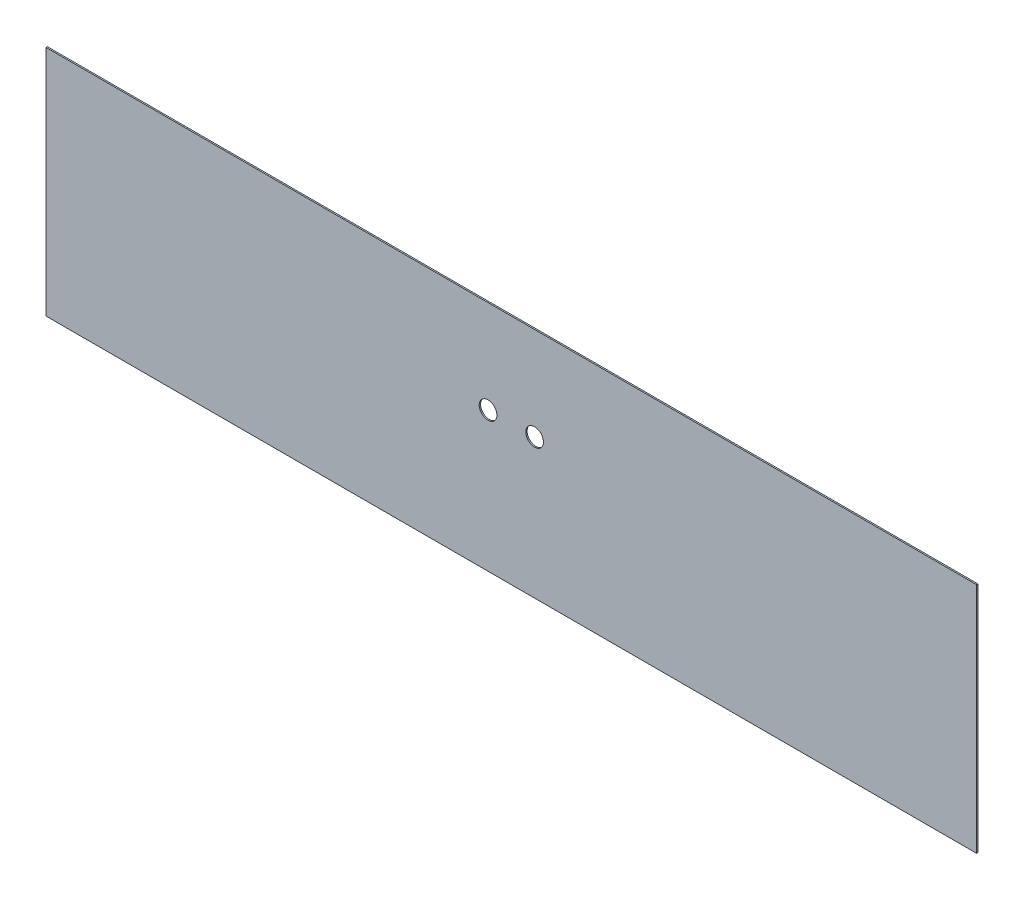
from build123d import *

# Parameters (mm, degrees)
SKETCH1_W          = 508
SKETCH1_H          = 127
BASE_FLANGE1_DEPTH = 0.7366
SKETCH2_R          = 4.826
CUT_EXTRUDE1_DEPTH = 2.54


# Sheet-metal steps are written as plain solids
with BuildPart() as part:
    # Sketch1 → Base-Flange1 (new body)
    with BuildSketch(Plane.XY):
        with Locations((254, 63.5)):
            Rectangle(SKETCH1_W, SKETCH1_H)
    extrude(amount=-BASE_FLANGE1_DEPTH)

    # Sketch2 → Cut-Extrude1 (cut)
    with BuildSketch(Plane.XY):
        with Locations((266.7, 76.2)):
            Circle(SKETCH2_R)
        with Locations((241.3, 76.2)):
            Circle(SKETCH2_R)
    extrude(amount=-CUT_EXTRUDE1_DEPTH, mode=Mode.SUBTRACT)


solid = part.part
